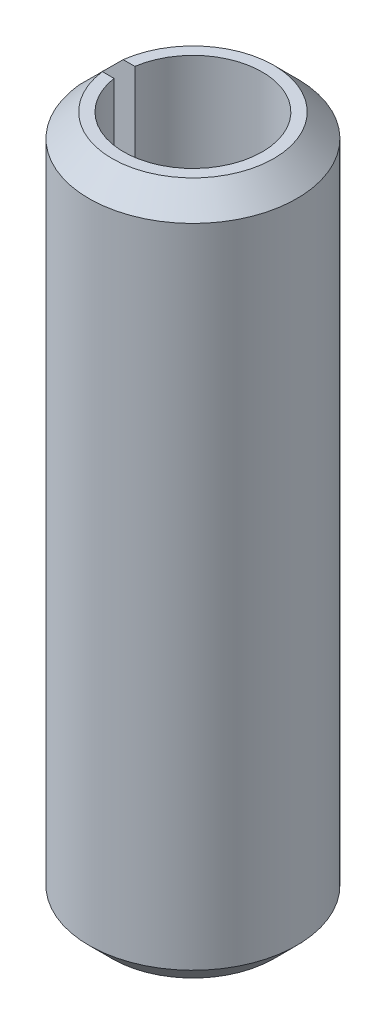
from build123d import *

# Parameters (mm, degrees)
ESQUISSE1_W                  = 1
ESQUISSE1_H                  = 20
ENL_V_MAT_EXTRU_1_DEPTH      = 11.862780491
ENL_V_MAT_EXTRU_1_DEPTH_BACK = 11.862780491
ESQUISSE2_W                  = 3
ESQUISSE2_H                  = 0.6


with BuildPart() as part:
    # Esquisse1 → Base-Révolution (revolve)
    with BuildSketch(Plane.XY, mode=Mode.PRIVATE) as base_r_volution_sk:
        with Locations((2.5, 0)):
            Rectangle(ESQUISSE1_W, ESQUISSE1_H)
    revolve(base_r_volution_sk.sketch.rotate(Axis((0, 10, 0), (0, -1, 0)), 90), axis=Axis((0, 10, 0), (0, -1, 0)))

    # Chanfrein1: read off the stored shape, not the designer's step
    # Chanfrein1 outline → Chanfrein1 (revolve, cut)
    with BuildSketch(Plane.XY):
        Polygon((3, 10), (2.333333333, 10), (3, 9.333333333), align=None)
        Polygon((3, -10), (3, -9.333333333), (2.333333333, -10), align=None)
    revolve(axis=Axis((0, 0, 0), (0, 1, 0)), mode=Mode.SUBTRACT)

    # Esquisse2 → Enlèv. mat.-Extru.1 (cut, two sides: drawn at the far end of the back side and taken through both)
    with BuildSketch(Plane(origin=(0, 0, 0), x_dir=(-1, 0, 0), z_dir=(0, 1, 0)).offset(-ENL_V_MAT_EXTRU_1_DEPTH_BACK)):
        with Locations((1.5, 0)):
            Rectangle(ESQUISSE2_W, ESQUISSE2_H)
    extrude(amount=ENL_V_MAT_EXTRU_1_DEPTH + ENL_V_MAT_EXTRU_1_DEPTH_BACK, mode=Mode.SUBTRACT)


solid = part.part
